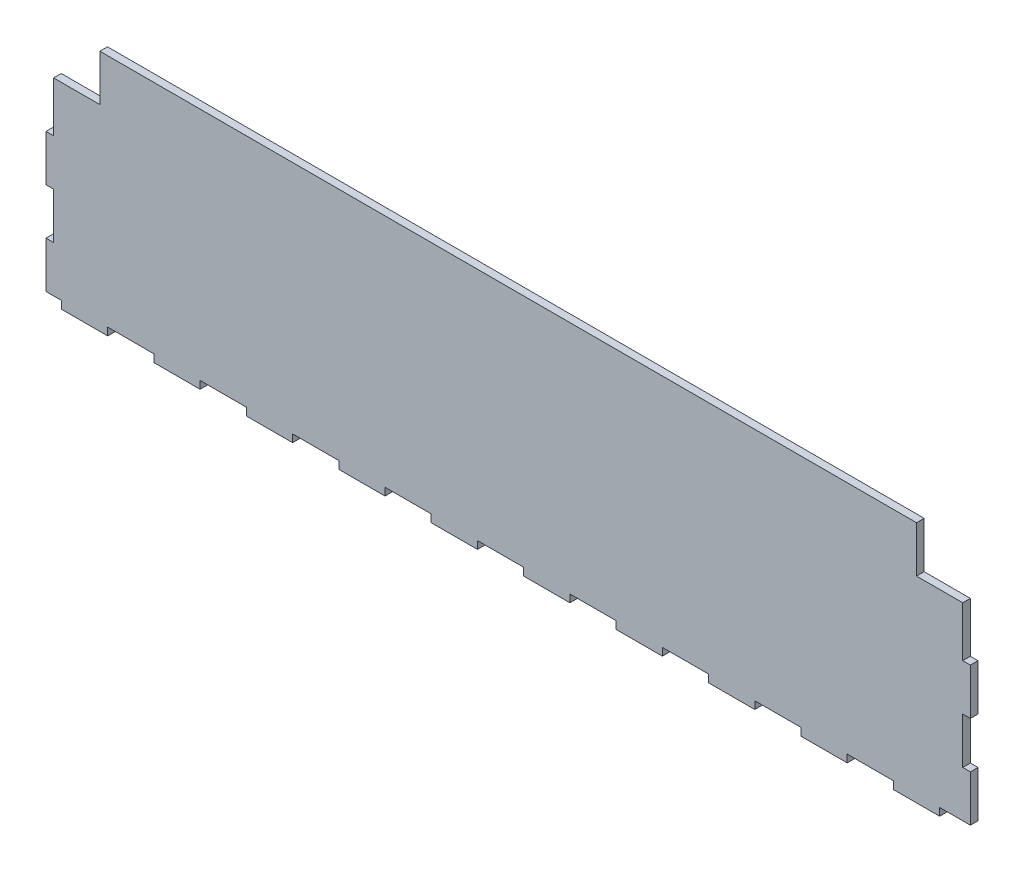
from build123d import *

# Parameters (mm, degrees)
BOSS_EXTRUDE1_DEPTH = 3.3
SKETCH2_W           = 20
SKETCH2_H           = 3.3
BOSS_EXTRUDE2_DEPTH = 3.3
SKETCH3_W           = 3.3
SKETCH3_H           = 20
BOSS_EXTRUDE3_DEPTH = 3.3


with BuildPart() as part:
    # Sketch1 → Boss-Extrude1 (new body)
    with BuildSketch(Plane.XY):
        Polygon((0, -121.512388365), (393.4, -121.512388365), (393.4, -39.804293747), (373.4, -39.804293747), (373.4, -19.804293747), (20, -19.804293747), (20, -39.804293747), (0, -39.804293747), align=None)
    extrude(amount=-BOSS_EXTRUDE1_DEPTH)

    # Sketch2 → Boss-Extrude2 (add)
    with BuildSketch(Plane.XY):
        with Locations((333.4, -123.162388333)):
            Rectangle(SKETCH2_W, SKETCH2_H)
        with Locations((373.4, -123.162388333)):
            Rectangle(SKETCH2_W, SKETCH2_H)
        with Locations((293.4, -123.162388333)):
            Rectangle(SKETCH2_W, SKETCH2_H)
        with Locations((253.4, -123.162388333)):
            Rectangle(SKETCH2_W, SKETCH2_H)
        with Locations((213.4, -123.162388333)):
            Rectangle(SKETCH2_W, SKETCH2_H)
        with Locations((173.4, -123.162388333)):
            Rectangle(SKETCH2_W, SKETCH2_H)
        with Locations((133.4, -123.162388333)):
            Rectangle(SKETCH2_W, SKETCH2_H)
        with Locations((93.4, -123.162388333)):
            Rectangle(SKETCH2_W, SKETCH2_H)
        with Locations((53.4, -123.162388333)):
            Rectangle(SKETCH2_W, SKETCH2_H)
        with Locations((13.4, -123.162388333)):
            Rectangle(SKETCH2_W, SKETCH2_H)
    extrude(amount=-BOSS_EXTRUDE2_DEPTH)

    # Sketch3 → Boss-Extrude3 (add)
    with BuildSketch(Plane.XY):
        with Locations((395.05, -111.512388365)):
            Rectangle(SKETCH3_W, SKETCH3_H)
        with Locations((395.05, -71.512388365)):
            Rectangle(SKETCH3_W, SKETCH3_H)
        with Locations((-1.65, -111.512388365)):
            Rectangle(SKETCH3_W, SKETCH3_H)
        with Locations((-1.65, -71.512388365)):
            Rectangle(SKETCH3_W, SKETCH3_H)
    extrude(amount=-BOSS_EXTRUDE3_DEPTH)


solid = part.part
